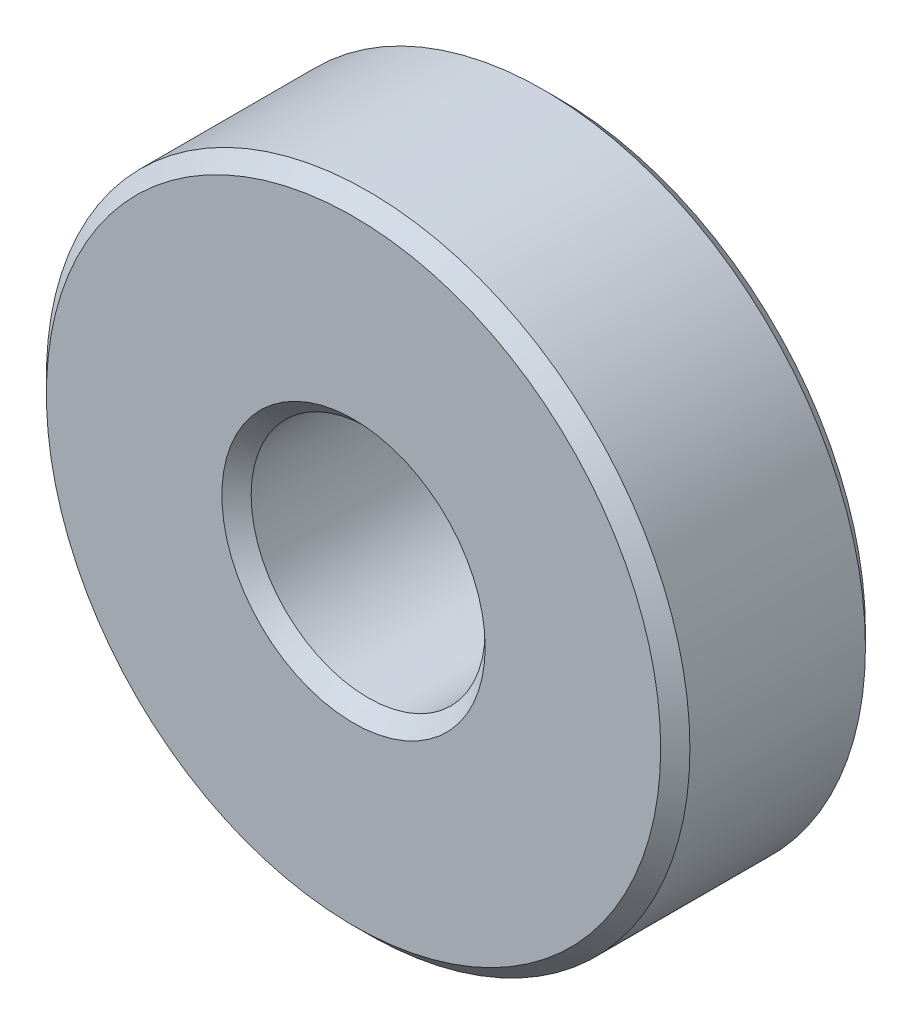
from build123d import *

# Parameters (mm, degrees)
SZKIC1_R                    = 11
SZKIC1_R_2                  = 4
DODANIE_WYCI_GNI_CIE1_DEPTH = 7
SFAZOWANIE1_SIZE            = 0.5


with BuildPart() as part:
    # Szkic1 → Dodanie-wyciągnięcie1 (new body)
    with BuildSketch(Plane.XY):
        Circle(SZKIC1_R)
        Circle(SZKIC1_R_2, mode=Mode.SUBTRACT)
    extrude(amount=DODANIE_WYCI_GNI_CIE1_DEPTH)

    # Sfazowanie1
    sfazowanie1_edges = [part.edges().sort_by_distance(p)[0] for p in [
        (-11, 0, 0),
        (-4, 0, 7),
        (-11, 0, 7),
    ]]
    chamfer(sfazowanie1_edges, length=SFAZOWANIE1_SIZE)


solid = part.part
